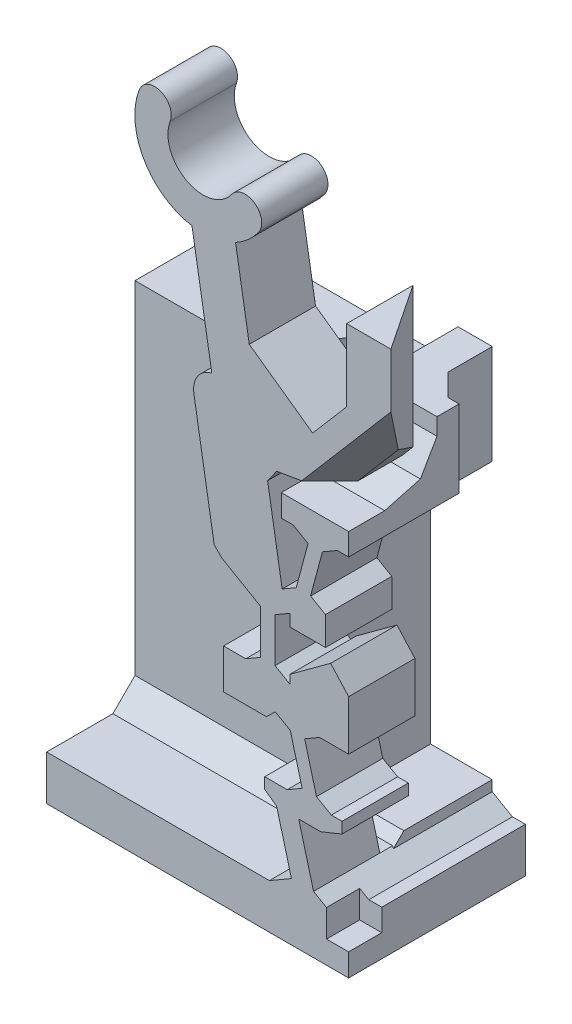
from build123d import *

# Parameters (mm, degrees)
BOSS_SWITCH_BODY_DEPTH                         = 3
SKETCH1_W                                      = 4
SKETCH1_H                                      = 3.5
BOSS_FLANGE_WIDTH_DEPTH                        = 5
BOSS_FLANGE_HEIGHT_REACH                       = 38.166
SKETCH2_W                                      = 4
SKETCH2_H                                      = 2
SKETCH2_W_2                                    = 8
SKETCH2_H_2                                    = 2.024975669
CUT_UP_TO_DOWN_DERAILLEUR_CLEARANCE_REACH      = 23.862
SKETCH10_W                                     = 2.453096586
SKETCH10_H                                     = 3
SKETCH17_W                                     = 12.1675
SKETCH17_H                                     = 4
BOSS_FLANGE_SUPPORT_DEPTH                      = 14.475024331
TAP_DRILL_FOR_M2X0_4_TAP1_D                    = 1.6
M2_CLEARANCE_HOLE2_D                           = 2.4
M2_CLEARANCE_HOLE2_DEPTH                       = 15
M2_CLEARANCE_HOLE2_TIP                         = 0.721032743
CUT_UP_TO_DOWN_CANTILEVER_SLOPE_REACH          = 31.347
CUT_DOWN_TO_UP_DERAILLEUR_CLEARANCE_DEPTH      = 33.69867621
CUT_DOWN_TO_UP_DERAILLEUR_CLEARANCE_DEPTH_BACK = 33.69867621
CHAMFER_FLANGE_SUPPORT_SIZE                    = 1.5
CHAMFER_FLANGE_SUPPORT_2_SIZE                  = 1
CHAMFER_FLANGE_SUPPORT_3_SIZE                  = 1
SKETCH18_W                                     = 1.5
SKETCH18_H                                     = 1.577328106
CUT_DOWN_TO_UP_DERAILLEUR_CLEARANCE_2_DEPTH    = 1
SKETCH19_W                                     = 3.046903414
SKETCH19_H                                     = 2.563581512
CUT_UP_TO_DOWN_CANTILEVER_CLEARANCE_DEPTH      = 1
CHAMFER1_SIZE                                  = 1
CHAMFER1_SIZE_2                                = 1.732050808
CHAMFER3_SIZE                                  = 0.75
CHAMFER3_SIZE_2                                = 1.299038106
CHAMFER4_SIZE                                  = 0.5
CHAMFER4_SIZE2                                 = 0.866025404
CHAMFER5_SIZE                                  = 0.5
CHAMFER6_SIZE                                  = 2.5
CHAMFER7_SIZE                                  = 1
CUT_EXTRUDE3_REACH                             = 33.008
CHAMFER8_SIZE                                  = 0.5
CHAMFER8_SIZE2                                 = 1.366025404
SKETCH23_W                                     = 2.791062273
SKETCH23_H                                     = 12.475024331
CUT_EXTRUDE4_DEPTH                             = 31.862053717


# Some blends are built 0.0001 mm under size
with BuildPart() as part:
    # Sketch-SwitchBossUp → Boss-Switch Body (new body)
    with BuildSketch(Plane.XY):
        with BuildLine():
            Line((6.540476927, 21.177422148), (6.540476927, 24.438379064))
            Line((6.540476927, 24.438379064), (8.540476927, 24.438379064))
            Line((8.540476927, 24.438379064), (8.540476927, 20.438379064))
            Line((8.540476927, 20.438379064), (6.040476927, 17.517528279))
            Line((6.040476927, 17.517528279), (2.878366495, 16.985217616))
            Line((2.878366495, 16.985217616), (3.620297651, 12.577888564))
            Line((3.620297651, 12.577888564), (4.256080915, 12.944958203))
            Line((4.256080915, 12.944958203), (4.791964496, 14.944962169))
            Line((4.791964496, 14.944962169), (4.116925685, 15.334689347))
            Line((4.116925685, 15.334689347), (3.581073513, 15.334689347))
            Line((3.581073513, 15.334689347), (3.581073513, 16.334689347))
            Line((3.581073513, 16.334689347), (6.857327822, 16.334689347))
            Line((6.857327822, 16.334689347), (13.441607507, 16.334689347))
            Line((13.441607507, 16.334689347), (13.441607507, -1.165310653))
            Line((13.441607507, -1.165310653), (5.040476927, -1.165310653))
            Line((5.040476927, -1.165310653), (3.040476927, -1.165310653))
            Line((3.040476927, -1.165310653), (3.040476927, 0.859665016))
            Line((3.040476927, 0.859665016), (4.040476927, 1.437015286))
            Line((4.040476927, 1.437015286), (3.370603946, 3.937015286))
            Line((3.370603946, 3.937015286), (2.83114552, 4.326718942))
            Line((2.83114552, 4.326718942), (2.83114552, 4.826718942))
            Line((2.83114552, 4.826718942), (3.58114552, 4.826718942))
            Line((3.58114552, 4.826718942), (3.849107629, 4.826718942))
            Line((3.849107629, 4.826718942), (4.524094713, 5.216429578))
            Line((4.524094713, 5.216429578), (3.988181525, 7.216425611))
            Line((3.988181525, 7.216425611), (3.311378308, 7.607171452))
            Line((3.311378308, 7.607171452), (2.9061262, 7.216422599))
            Line((2.9061262, 7.216422599), (0.971281627, 7.216422599))
            Line((0.971281627, 7.216422599), (0.971281627, 9.019692757))
            Line((0.971281627, 9.019692757), (1.971281627, 9.019692757))
            Line((1.971281627, 9.019692757), (2.646271341, 9.40939825))
            Line((2.646271341, 9.40939825), (2.646271341, 11.40939825))
            Line((2.646271341, 11.40939825), (0.897326855, 12.41915182))
            Line((0.897326855, 12.41915182), (0.545466745, 12.771663724))
            Line((0.545466745, 12.771663724), (-0.372784255, 18.226393961))
            ThreePointArc((-0.372784255, 18.226393961), (-0.209313172, 18.996084896), (0.435897335, 19.446473985))
            Line((0.435897335, 19.446473985), (-0.46073685, 24.772792819))
            ThreePointArc((-0.46073685, 24.772792819), (-2.630501593, 26.270619745), (-2.852546321, 28.897797067))
            ThreePointArc((-2.852546321, 28.897797067), (-1.887813913, 29.338582026), (-1.447028953, 28.373849618))
            ThreePointArc((-1.447028953, 28.373849618), (-0.703448682, 26.416936722), (1.333779254, 26.898727173))
            ThreePointArc((1.333779254, 26.898727173), (2.379722745, 27.074801628), (2.555797201, 26.028858137))
            ThreePointArc((2.555797201, 26.028858137), (2.086504637, 25.507104397), (1.511513111, 25.104801997))
            Line((1.511513111, 25.104801997), (2.546357317, 18.957467576))
            Line((2.546357317, 18.957467576), (4.992893704, 19.36931828))
            Line((4.992893704, 19.36931828), (6.540476927, 21.177422148))
        make_face()
        Polygon((5.581091201, 12.555245643), (5.581100766, 11.263016278), (3.971265023, 11.263016278), (3.97126394, 11.79911022), (3.296271341, 11.409403061), (3.296271341, 9.409403061), (3.971278743, 9.019687356), (3.971278743, 9.409408058), (5.815189335, 10.763016278), (6.627976927, 9.860324206), (6.627976927, 8.365258971), (6.627976927, 7.607171452), (5.314953271, 7.607171452), (4.638181525, 7.216430422), (5.174094713, 5.216434389), (5.845334952, 4.828900281), (6.33114552, 4.828900281), (6.33114552, 4.328900281), (5.370603946, 3.937015286), (4.370603946, 3.937015286), (5.040476927, 1.437015286), (6.040489723, 0.85968718), (9.127976927, 0.85968718), (10.437466736, 2.169176988), (10.437466736, 14.025199539), (9.127976927, 15.334689347), (6.116971898, 15.334689347), (5.441964496, 14.94496698), (4.906080915, 12.944963014), align=None, mode=Mode.SUBTRACT)
    extrude(amount=BOSS_SWITCH_BODY_DEPTH)

    # Sketch1 → Boss-Flange Width (add)
    with BuildSketch(Plane(origin=(0, 0, 0), x_dir=(-1, 0, 0), z_dir=(0, 0, -1))):
        Polygon((-7.581073513, -1.165310653), (0.412170615, -1.165310653), (0.412170615, 0.859665016), (-3.040476927, 0.859665016), (-4.040476927, 1.437015286), (-5.040476927, 1.437015286), (-6.040489723, 0.85968718), (-7.581073513, 0.85968718), align=None)
        with Locations((-5.581073513, 17.084689347)):
            Rectangle(SKETCH1_W, SKETCH1_H)
    extrude(amount=BOSS_FLANGE_WIDTH_DEPTH)

    # Sketch2 → Boss-Flange Height (add, up to next)
    with BuildSketch(Plane(origin=(-7.039523073, 0, 0), x_dir=(0, 0, -1), z_dir=(1, 0, 0)), mode=Mode.PRIVATE) as boss_flange_height_sk1:
        with Locations((3, 16.334689347)):
            Rectangle(SKETCH2_W, SKETCH2_H)
    boss_flange_height_tool1 = extrude(boss_flange_height_sk1.sketch, amount=BOSS_FLANGE_HEIGHT_REACH, mode=Mode.PRIVATE) - part.part
    # Sketch2 → Boss-Flange Height (add, up to next)
    with BuildSketch(Plane(origin=(-7.039523073, 0, 0), x_dir=(0, 0, -1), z_dir=(1, 0, 0)), mode=Mode.PRIVATE) as boss_flange_height_sk2:
        with Locations((1, -0.152822819)):
            Rectangle(SKETCH2_W_2, SKETCH2_H_2)
    boss_flange_height_tool2 = extrude(boss_flange_height_sk2.sketch, amount=BOSS_FLANGE_HEIGHT_REACH, mode=Mode.PRIVATE) - part.part
    add(boss_flange_height_tool1.solids().sort_by_distance((-7.039523, 16.334689, -3))[0])
    add(boss_flange_height_tool2.solids().sort_by_distance((-7.039523, -0.152823, -1))[0])

    # Sketch10 → Cut-Up-To-Down Derailleur Clearance (cut, up to next)
    with BuildSketch(Plane(origin=(0, 15.334689347, 0), x_dir=(1, 0, 0), z_dir=(0, 1, 0)), mode=Mode.PRIVATE) as cut_up_to_down_derailleur_clearance_sk1:
        with Locations((6.35452522, 3.5)):
            Rectangle(SKETCH10_W, SKETCH10_H)
    cut_up_to_down_derailleur_clearance_tool1 = extrude(cut_up_to_down_derailleur_clearance_sk1.sketch, amount=CUT_UP_TO_DOWN_DERAILLEUR_CLEARANCE_REACH, mode=Mode.PRIVATE) & part.part
    add(cut_up_to_down_derailleur_clearance_tool1.solids().sort_by_distance((6.354525, 15.334689, -3.5))[0], mode=Mode.SUBTRACT)

    # Sketch17 → Boss-Flange Support (add)
    with BuildSketch(Plane.XZ.offset(-15.334689347)):
        with Locations((-0.955773073, -3)):
            Rectangle(SKETCH17_W, SKETCH17_H)
    extrude(amount=BOSS_FLANGE_SUPPORT_DEPTH)

    # Tap Drill for M2x0.4 Tap1 (through all)
    with Locations(Plane(origin=(0, -1.165310653, 0), x_dir=(-1, 0, 0), z_dir=(0, -1, 0))):
        with Locations((4.039523073, 3), (-0.581073513, 3)):
            Hole(TAP_DRILL_FOR_M2X0_4_TAP1_D / 2)

    # M2 Clearance Hole2
    with Locations(Plane.XZ.offset(1.165310653)):
        with Locations((-4.039523073, -3), (0.581073513, -3)):
            Hole(M2_CLEARANCE_HOLE2_D / 2, depth=M2_CLEARANCE_HOLE2_DEPTH)
            with Locations((0, 0, -(M2_CLEARANCE_HOLE2_DEPTH + M2_CLEARANCE_HOLE2_TIP / 2))):  # 118° drill point
                Cone(0, M2_CLEARANCE_HOLE2_D / 2, M2_CLEARANCE_HOLE2_TIP, mode=Mode.SUBTRACT)

    # Sketch12 → Cut-Up-to-Down Cantilever Slope (cut, up to next)
    with BuildSketch(Plane(origin=(0, 24.438379064, 0), x_dir=(1, 0, 0), z_dir=(0, 1, 0)), mode=Mode.PRIVATE) as cut_up_to_down_cantilever_slope_sk1:
        Polygon((6.540476927, 0), (8.540476927, -3), (8.540476927, 0), align=None)
    cut_up_to_down_cantilever_slope_tool1 = extrude(cut_up_to_down_cantilever_slope_sk1.sketch, amount=-CUT_UP_TO_DOWN_CANTILEVER_SLOPE_REACH, mode=Mode.PRIVATE) & part.part
    add(cut_up_to_down_cantilever_slope_tool1.solids().sort_by_distance((7.87381, 24.438379, 1))[0], mode=Mode.SUBTRACT)

    # Sketch16 → Cut-Down-to-Up Derailleur Clearance (cut, two sides: drawn at the far end of the back side and taken through both)
    with BuildSketch(Plane(origin=(0, 0, 0), x_dir=(-1, 0, 0), z_dir=(0, 0, -1)).offset(-CUT_DOWN_TO_UP_DERAILLEUR_CLEARANCE_DEPTH_BACK)):
        Polygon((-7.581073513, 18.834689347), (-13.441607507, 18.834689347), (-13.441607507, -1.165310653), (-6.627976927, -1.165310653), (-6.627976927, 5.203794929), (-8.003689255, 5.203794929), (-8.003689255, 12.048417413), (-6.627976927, 12.048417413), (-6.627976927, 17.947659965), align=None)
    extrude(amount=CUT_DOWN_TO_UP_DERAILLEUR_CLEARANCE_DEPTH + CUT_DOWN_TO_UP_DERAILLEUR_CLEARANCE_DEPTH_BACK, mode=Mode.SUBTRACT)

    # Chamfer-Flange Support
    chamfer_flange_support_edges = [part.edges().sort_by_distance(p)[0] for p in [
        (3.581073513, 17.334689347, -3),
    ]]
    chamfer(chamfer_flange_support_edges, length=CHAMFER_FLANGE_SUPPORT_SIZE - 0.0001)  # a hair under: the kernel refuses the full size

    # Chamfer-Flange Support 2
    chamfer_flange_support_2_edges = [part.edges().sort_by_distance(p)[0] for p in [
        (5.127976927, 17.084689347, -2),
        (5.127976927, 15.334689347, -1.5),
    ]]
    chamfer(chamfer_flange_support_2_edges, length=CHAMFER_FLANGE_SUPPORT_2_SIZE)

    # Chamfer-Flange Support 3
    chamfer_flange_support_3_edges = [part.edges().sort_by_distance(p)[0] for p in [
        (-1.999523073, 0.859665016, -1),
    ]]
    chamfer(chamfer_flange_support_3_edges, length=CHAMFER_FLANGE_SUPPORT_3_SIZE)

    # Sketch18 → Cut-Down-to-Up Derailleur Clearance 2 (cut)
    with BuildSketch(Plane(origin=(6.627976927, 0, 0), x_dir=(0, 0, -1), z_dir=(1, 0, 0))):
        with Locations((-2.25, 0.648351233)):
            Rectangle(SKETCH18_W, SKETCH18_H)
    extrude(amount=-CUT_DOWN_TO_UP_DERAILLEUR_CLEARANCE_2_DEPTH, mode=Mode.SUBTRACT)

    # Sketch19 → Cut-Up-to-Down Cantilever Clearance (cut)
    with BuildSketch(Plane.XY):
        with Locations((5.10452522, 17.616480103)):
            Rectangle(SKETCH19_W, SKETCH19_H)
    extrude(amount=-CUT_UP_TO_DOWN_CANTILEVER_CLEARANCE_DEPTH, mode=Mode.SUBTRACT)

    # Chamfer1
    # the kernel refuses this chamfer: 1.732050808, 1 mm, written as the material it adds along each edge
    with BuildSketch(Plane(origin=(6.627976927, 16.334689347, -1), x_dir=(0, -0.05789386240266977, 0.9983227437537926), z_dir=(-1, 0, 0))) as chamfer1_piece_1:
        Polygon((CHAMFER1_SIZE * 0.998322743754, CHAMFER1_SIZE * 0.0578938624027), (-CHAMFER1_SIZE_2 * 0.0578938623883, CHAMFER1_SIZE_2 * 0.998322743505), (0, 0), align=None)
    extrude(amount=3.046903414)

    # Chamfer3
    # the kernel refuses this chamfer: 1.299038106, 0.75 mm, written as the material it adds along each edge
    with BuildSketch(Plane(origin=(3.581073513, 15.334689347, -1), x_dir=(0.05789386240236086, -1.5934376059306423e-13, 0.9983227437538106), z_dir=(0, 1, 0))) as chamfer3_piece_1_section:
        Polygon((CHAMFER3_SIZE * 0.998322743754, -CHAMFER3_SIZE * 0.0578938624027), (-CHAMFER3_SIZE_2 * 0.057893862388, -CHAMFER3_SIZE_2 * 0.998322743505), (0, 0), align=None)
    chamfer3_piece_1 = extrude(amount=6.092773786, mode=Mode.PRIVATE)
    chamfer3_piece_1 = split(chamfer3_piece_1, bisect_by=Plane(origin=(3.127107762, 16.799062109, -0.268105739), z_dir=(0, -0.4999999999999566, -0.8660254037844637)), keep=Keep.TOP, mode=Mode.PRIVATE)
    chamfer3_piece_1 = split(chamfer3_piece_1, bisect_by=Plane(origin=(2.18713947, 17.440655304, -0.784906566), z_dir=(0.7071067811865476, -0.7071067811865476, 0)), keep=Keep.TOP, mode=Mode.PRIVATE)
    add(chamfer3_piece_1)

    # Chamfer4
    chamfer4_edges = [part.edges().sort_by_distance(p)[0] for p in [
        (4.205006167, 15.334689347, -1),
    ]]
    chamfer4_side = [part.faces().sort_by_distance(p)[0] for p in [
        (2.964678171, 15.334689347, -0.682371949),
    ]]
    chamfer(chamfer4_edges, length=CHAMFER4_SIZE, length2=CHAMFER4_SIZE2, reference=chamfer4_side[0])

    # Chamfer5
    chamfer5_edges = [part.edges().sort_by_distance(p)[0] for p in [
        (2.878366495, 16.985217616, 1.5),
    ]]
    chamfer(chamfer5_edges, length=CHAMFER5_SIZE)

    # Chamfer6
    # the kernel refuses this chamfer: 2.5 mm, written as the material it adds along each edge
    with BuildSketch(Plane(origin=(2.546357317, 18.957467576, 0), x_dir=(0.9903165846799726, 0.13882745444541758, 0), z_dir=(0, 0, 1))) as chamfer6_piece_1:
        Polygon((CHAMFER6_SIZE * 0.999621916911, CHAMFER6_SIZE * 0.0274958766106), (-CHAMFER6_SIZE * 0.0274958766106, CHAMFER6_SIZE * 0.999621916911), (0, 0), align=None)
    extrude(amount=3)

    # Chamfer7
    chamfer7_edges = [part.edges().sort_by_distance(p)[0] for p in [
        (7.290476927, 18.977953671, 3),
    ]]
    chamfer(chamfer7_edges, length=CHAMFER7_SIZE)

    # Sketch22 → Cut-Extrude3 (cut, up to next)
    with BuildSketch(Plane.XY, mode=Mode.PRIVATE) as cut_extrude3_sk1:
        Polygon((6.627976927, 17.947659965), (7.581073513, 18.834689347), (6.627976927, 18.834689347), align=None)
    cut_extrude3_tool1 = extrude(cut_extrude3_sk1.sketch, amount=-CUT_EXTRUDE3_REACH, mode=Mode.PRIVATE) & part.part
    add(cut_extrude3_tool1.solids().sort_by_distance((6.945676, 18.539013, 0))[0], mode=Mode.SUBTRACT)

    # Chamfer8
    chamfer8_edges = [part.edges().sort_by_distance(p)[0] for p in [
        (5.10452522, 16.334689347, 0),
    ]]
    chamfer8_side = [part.faces().sort_by_distance(p)[0] for p in [
        (4.861507649, 17.252033573, -0.529628936),
    ]]
    chamfer(chamfer8_edges, length=CHAMFER8_SIZE, length2=CHAMFER8_SIZE2, reference=chamfer8_side[0])

    # Sketch23 → Cut-Extrude4 (cut, through all)
    with BuildSketch(Plane.XY.offset(-1)):
        with Locations((3.732445791, 8.097177182)):
            Rectangle(SKETCH23_W, SKETCH23_H)
    extrude(amount=-CUT_EXTRUDE4_DEPTH, mode=Mode.SUBTRACT)


solid = part.part
